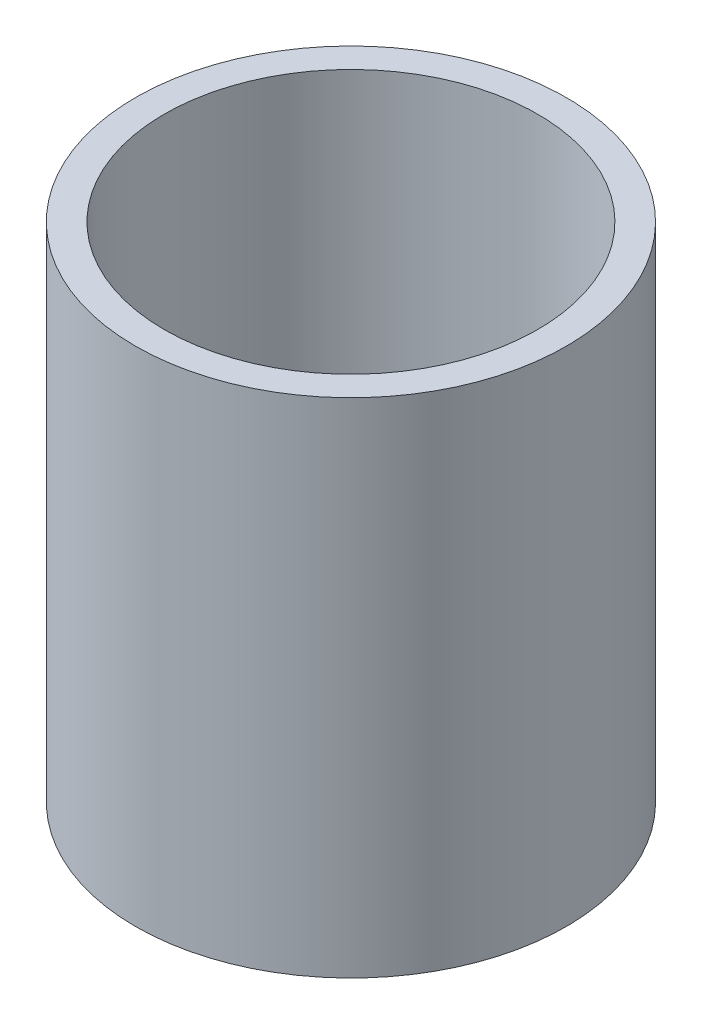
from build123d import *

# Parameters (mm, degrees)
SKETCH1_R               = 15
BOSS_EXTRUDE1_DEPTH     = 35
SHELL1_T                = -2
ADVANCEDHOLE1_OUTLINE_R = 3
ADVANCEDHOLE1_DEPTH     = 2


# Read off the part's stored shape, not the designer's step: AdvancedHole1
with BuildPart() as part:
    # Sketch1 → Boss-Extrude1 (new body)
    with BuildSketch(Plane(origin=(0, 0, 0), x_dir=(1, 0, 0), z_dir=(0, 1, 0))):
        with Locations(Location((-13.930579922, 15.357614938, 0), (0, 0, 270))):
            Circle(SKETCH1_R)
    extrude(amount=BOSS_EXTRUDE1_DEPTH)

    # Shell1
    shell1_openings = [part.faces().sort_by_distance(p)[0] for p in [
        (-13.930579922, 35, -15.357614938),
    ]]
    offset(amount=SHELL1_T, openings=shell1_openings, kind=Kind.INTERSECTION)

    # AdvancedHole1 outline → AdvancedHole1 (cut)
    with BuildSketch(Plane(origin=(0, 0, 0), x_dir=(1, 0, 0), z_dir=(0, 1, 0))):
        with Locations((-13.850292644, 15.457974035)):
            Circle(ADVANCEDHOLE1_OUTLINE_R)
    extrude(amount=ADVANCEDHOLE1_DEPTH, mode=Mode.SUBTRACT)


solid = part.part
